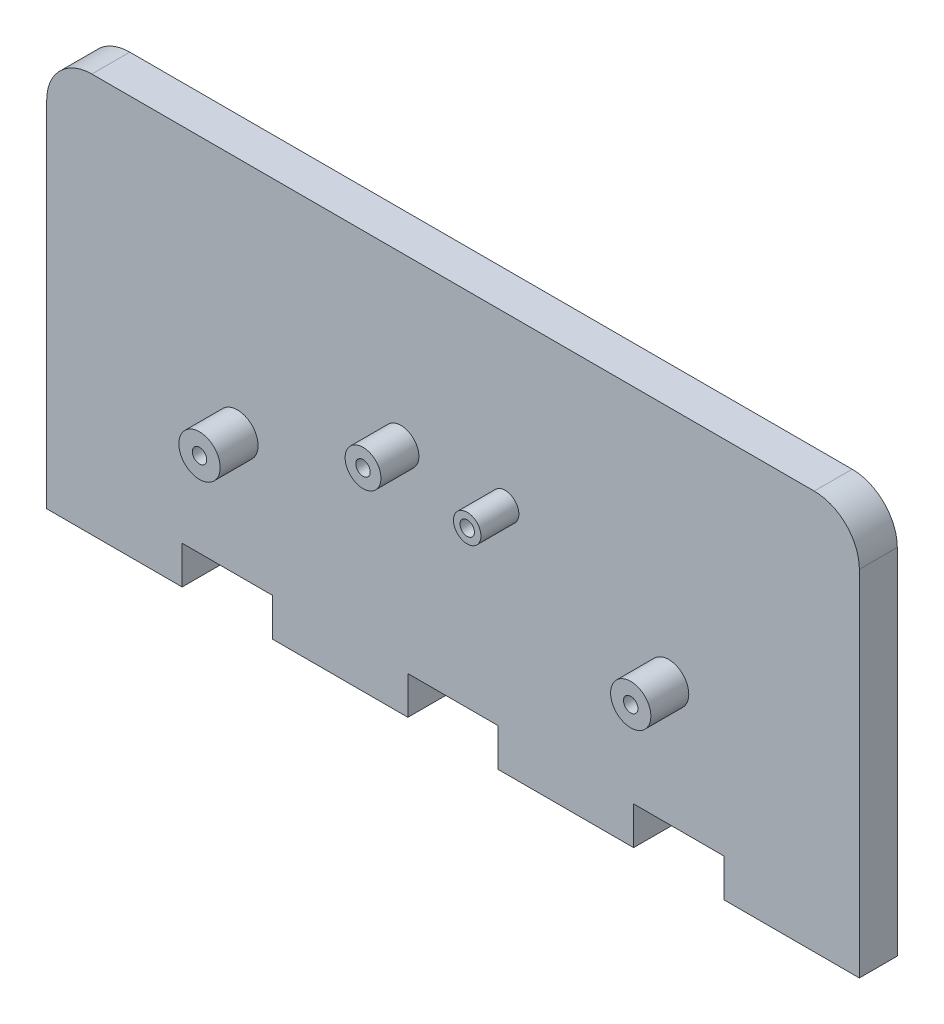
from build123d import *

# Parameters (mm, degrees)
SKETCH1_W           = 114.3
SKETCH1_H           = 56.134
BOSS_EXTRUDE1_DEPTH = 5.334
SKETCH2_W           = 12.7
SKETCH2_H           = 5.334
CUT_EXTRUDE1_DEPTH  = 90.417531181
FILLET1_R           = 6.35
SKETCH3_R           = 1.5
CUT_EXTRUDE2_DEPTH  = 90.417531181
SKETCH4_R           = 2.903853153
SKETCH4_R_2         = 1.016
BOSS_EXTRUDE2_DEPTH = 5.334
SKETCH5_R           = 2.519106244
SKETCH5_R_2         = 1.016
BOSS_EXTRUDE3_DEPTH = 5.334
SKETCH6_R           = 1.932331933
SKETCH6_R_2         = 1.016
BOSS_EXTRUDE4_DEPTH = 5.334
SKETCH7_R           = 2.830766808
SKETCH7_R_2         = 1.016
BOSS_EXTRUDE5_DEPTH = 5.334


with BuildPart() as part:
    # Sketch1 → Boss-Extrude1 (new body)
    with BuildSketch(Plane.XY):
        with Locations((26.61749153, -2.755892293)):
            Rectangle(SKETCH1_W, SKETCH1_H)
    extrude(amount=BOSS_EXTRUDE1_DEPTH)

    # Sketch2 → Cut-Extrude1 (cut, through all)
    with BuildSketch(Plane.XY.offset(5.334)):
        with Locations((-5.13250847, -28.155892293)):
            Rectangle(SKETCH2_W, SKETCH2_H)
        with Locations((26.61749153, -28.155892293)):
            Rectangle(SKETCH2_W, SKETCH2_H)
        with Locations((58.36749153, -28.155892293)):
            Rectangle(SKETCH2_W, SKETCH2_H)
    extrude(amount=-CUT_EXTRUDE1_DEPTH, mode=Mode.SUBTRACT)

    # Fillet1
    fillet1_edges = [part.edges().sort_by_distance(p)[0] for p in [
        (83.76749153, 25.311107707, 2.667),
        (-30.53250847, 25.311107707, 2.667),
    ]]
    fillet(fillet1_edges, radius=FILLET1_R)

    # Sketch3 → Cut-Extrude2 (cut, through all)
    with BuildSketch(Plane(origin=(0, 0, 0), x_dir=(-1, 0, 0), z_dir=(0, 0, -1))):
        with Locations((3.70850847, -8.264892293)):
            Circle(SKETCH3_R)
        with Locations((-19.29149153, 1.735107707)):
            Circle(SKETCH3_R)
        with Locations((-56.94349153, -8.264892293)):
            Circle(SKETCH3_R)
        with Locations((-33.94349153, 1.735107707)):
            Circle(SKETCH3_R)
    extrude(amount=-CUT_EXTRUDE2_DEPTH, mode=Mode.SUBTRACT)

    # Sketch4 → Boss-Extrude2 (add)
    with BuildSketch(Plane.XY.offset(5.334)):
        with Locations((-3.70850847, -8.264892293)):
            Circle(SKETCH4_R)
        with Locations((-3.70850847, -8.264892293)):
            Circle(SKETCH4_R_2, mode=Mode.SUBTRACT)
    extrude(amount=BOSS_EXTRUDE2_DEPTH)

    # Sketch5 → Boss-Extrude3 (add)
    with BuildSketch(Plane.XY.offset(5.334)):
        with Locations((19.29149153, 1.735107707)):
            Circle(SKETCH5_R)
        with Locations((19.29149153, 1.735107707)):
            Circle(SKETCH5_R_2, mode=Mode.SUBTRACT)
    extrude(amount=BOSS_EXTRUDE3_DEPTH)

    # Sketch6 → Boss-Extrude4 (add)
    with BuildSketch(Plane.XY.offset(5.334)):
        with Locations((33.94349153, 1.735107707)):
            Circle(SKETCH6_R)
        with Locations((33.94349153, 1.735107707)):
            Circle(SKETCH6_R_2, mode=Mode.SUBTRACT)
    extrude(amount=BOSS_EXTRUDE4_DEPTH)

    # Sketch7 → Boss-Extrude5 (add)
    with BuildSketch(Plane.XY.offset(5.334)):
        with Locations((56.94349153, -8.264892293)):
            Circle(SKETCH7_R)
        with Locations((56.94349153, -8.264892293)):
            Circle(SKETCH7_R_2, mode=Mode.SUBTRACT)
    extrude(amount=BOSS_EXTRUDE5_DEPTH)


solid = part.part
